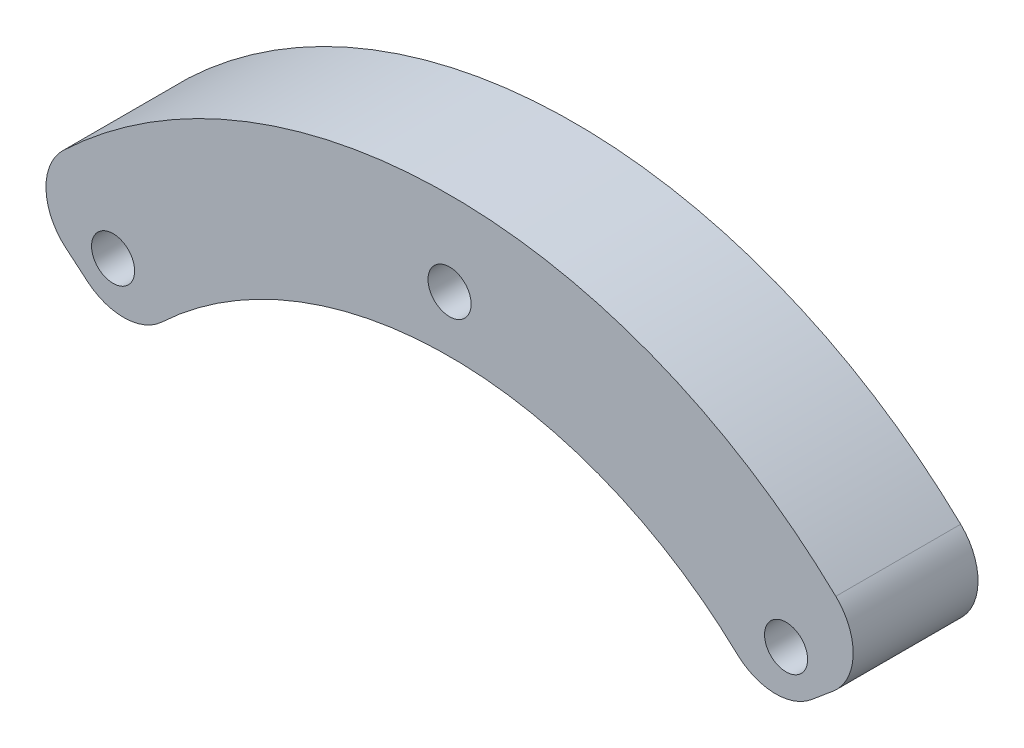
from build123d import *

# Parameters (mm, degrees)
SKETCH_1_R      = 1.925
EXTRUDE_1_DEPTH = 11.15
FILLET_3_R      = 5


with BuildPart() as part:
    # 草图1 → 凸台-拉伸1 (new body)
    with BuildSketch(Plane.XY):
        with BuildLine():
            Line((28.726666617, 24.104535363), (38.302222156, 32.139380484))
            ThreePointArc((38.302222156, 32.139380484), (0, 50), (-38.302222156, 32.139380484))
            Line((-38.302222156, 32.139380484), (-28.726666617, 24.104535363))
            ThreePointArc((-28.726666617, 24.104535363), (0, 37.5), (28.726666617, 24.104535363))
        make_face()
        with Locations((0, 42.5)):
            Circle(SKETCH_1_R, mode=Mode.SUBTRACT)
        with Locations((30.0520382, 30.0520382)):
            Circle(SKETCH_1_R, mode=Mode.SUBTRACT)
        with Locations((-30.0520382, 30.0520382)):
            Circle(SKETCH_1_R, mode=Mode.SUBTRACT)
    extrude(amount=EXTRUDE_1_DEPTH)

    # 圆角3
    fillet_3_edges = [part.edges().sort_by_distance(p)[0] for p in [
        (38.302222156, 32.139380484, 5.575),
        (28.726666617, 24.104535363, 5.575),
        (-28.726666617, 24.104535363, 5.575),
        (-38.302222156, 32.139380484, 5.575),
    ]]
    fillet(fillet_3_edges, radius=FILLET_3_R)


solid = part.part
